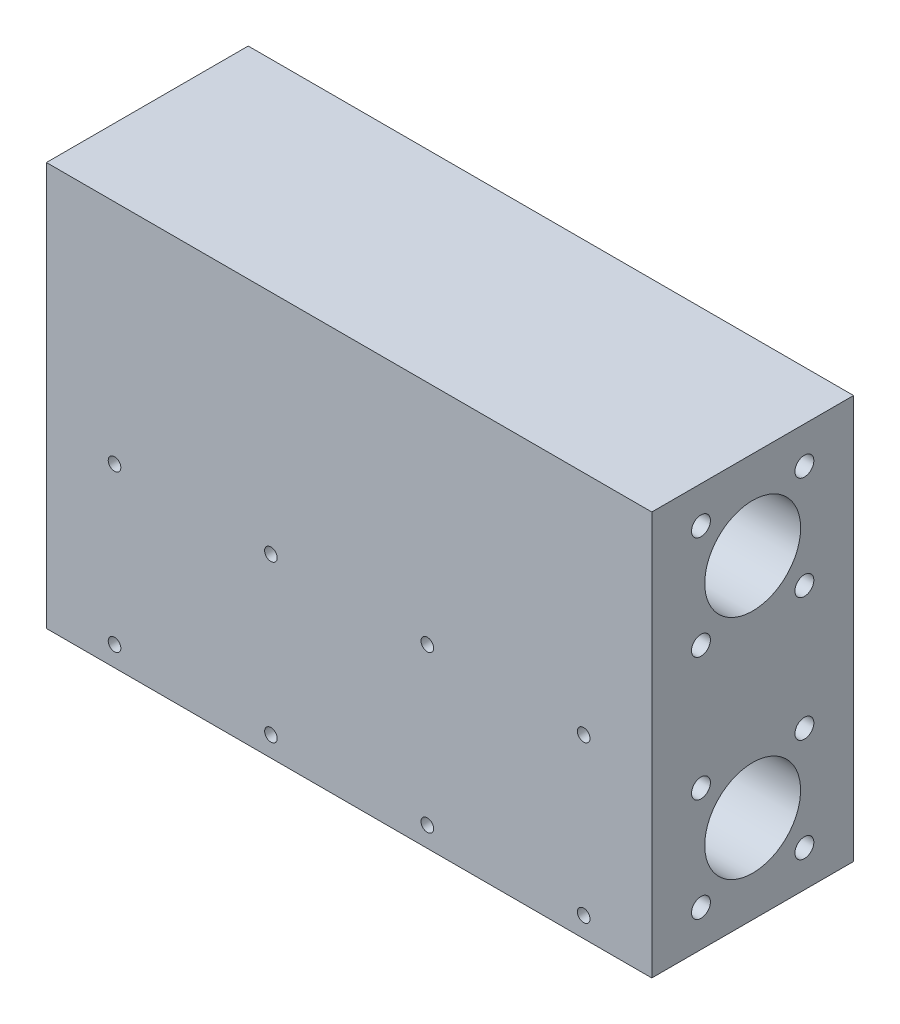
from build123d import *

# Parameters (mm, degrees)
SKETCH1_W                        = 120
SKETCH1_H                        = 80
BOSS_EXTRUDE1_DEPTH              = 40
SKETCH2_R                        = 1.85
LINEAR_BEARING_SCREW_CUTS_DEPTH  = 14
SKETCH3_R                        = 9.5
LINEAR_BEARINGS_HOLE_DEPTH       = 55
SKETCH4_R                        = 1.875
LINEAR_BEARING_SCREW_CUTS2_DEPTH = 14
LINEAR_BEARINGS_HOLE2_START      = -55
SKETCH5_R                        = 9.5
LINEAR_BEARINGS_HOLE2_DEPTH      = 55
SKETCH11_R                       = 1.25
CUT_EXTRUDE8_DEPTH               = 150.666295471


with BuildPart() as part:
    # Sketch1 → Boss-Extrude1 (new body)
    with BuildSketch(Plane.XY):
        with Locations((60, 40)):
            Rectangle(SKETCH1_W, SKETCH1_H)
    extrude(amount=BOSS_EXTRUDE1_DEPTH)

    # Sketch2 → linear-bearing-screw-cuts (cut)
    with BuildSketch(Plane.ZY):
        with Locations((30.25, 72.75)):
            Circle(SKETCH2_R)
        with Locations((9.75, 72.75)):
            Circle(SKETCH2_R)
        with Locations((30.25, 52.25)):
            Circle(SKETCH2_R)
        with Locations((9.75, 52.25)):
            Circle(SKETCH2_R)
        with Locations((9.75, 27.75)):
            Circle(SKETCH2_R)
        with Locations((30.25, 27.75)):
            Circle(SKETCH2_R)
        with Locations((30.25, 7.25)):
            Circle(SKETCH2_R)
        with Locations((9.75, 7.25)):
            Circle(SKETCH2_R)
    extrude(amount=-LINEAR_BEARING_SCREW_CUTS_DEPTH, mode=Mode.SUBTRACT)

    # Sketch3 → linear-bearings-hole (cut)
    with BuildSketch(Plane.ZY):
        with Locations((20, 62.5)):
            Circle(SKETCH3_R)
        with Locations((20, 17.5)):
            Circle(SKETCH3_R)
    extrude(amount=-LINEAR_BEARINGS_HOLE_DEPTH, mode=Mode.SUBTRACT)

    # Sketch4 → linear-bearing-screw-cuts2 (cut)
    with BuildSketch(Plane(origin=(120, 0, 0), x_dir=(0, 0, -1), z_dir=(1, 0, 0))):
        with Locations((-9.75, 72.75)):
            Circle(SKETCH4_R)
        with Locations((-30.25, 72.75)):
            Circle(SKETCH4_R)
        with Locations((-9.75, 52.25)):
            Circle(SKETCH4_R)
        with Locations((-30.25, 52.25)):
            Circle(SKETCH4_R)
        with Locations((-30.25, 27.75)):
            Circle(SKETCH4_R)
        with Locations((-9.75, 27.75)):
            Circle(SKETCH4_R)
        with Locations((-9.75, 7.25)):
            Circle(SKETCH4_R)
        with Locations((-30.25, 7.25)):
            Circle(SKETCH4_R)
    extrude(amount=-LINEAR_BEARING_SCREW_CUTS2_DEPTH, mode=Mode.SUBTRACT)

    # Sketch5 → linear-bearings-hole2 (cut)
    with BuildSketch(Plane(origin=(120, 0, 0), x_dir=(0, 0, -1), z_dir=(1, 0, 0)).offset(LINEAR_BEARINGS_HOLE2_START)):
        with Locations((-20, 62.5)):
            Circle(SKETCH5_R)
        with Locations((-20, 17.5)):
            Circle(SKETCH5_R)
    extrude(amount=LINEAR_BEARINGS_HOLE2_DEPTH, mode=Mode.SUBTRACT)

    # Sketch11 → Cut-Extrude8 (cut, through all)
    with BuildSketch(Plane.XY.offset(40)):
        with Locations((13.5, 35)):
            Circle(SKETCH11_R)
        with Locations((44.5, 35)):
            Circle(SKETCH11_R)
        with Locations((75.5, 35)):
            Circle(SKETCH11_R)
        with Locations((106.5, 35)):
            Circle(SKETCH11_R)
        with Locations((13.5, 4)):
            Circle(SKETCH11_R)
        with Locations((44.5, 4)):
            Circle(SKETCH11_R)
        with Locations((75.5, 4)):
            Circle(SKETCH11_R)
        with Locations((106.5, 4)):
            Circle(SKETCH11_R)
    extrude(amount=-CUT_EXTRUDE8_DEPTH, mode=Mode.SUBTRACT)


solid = part.part
